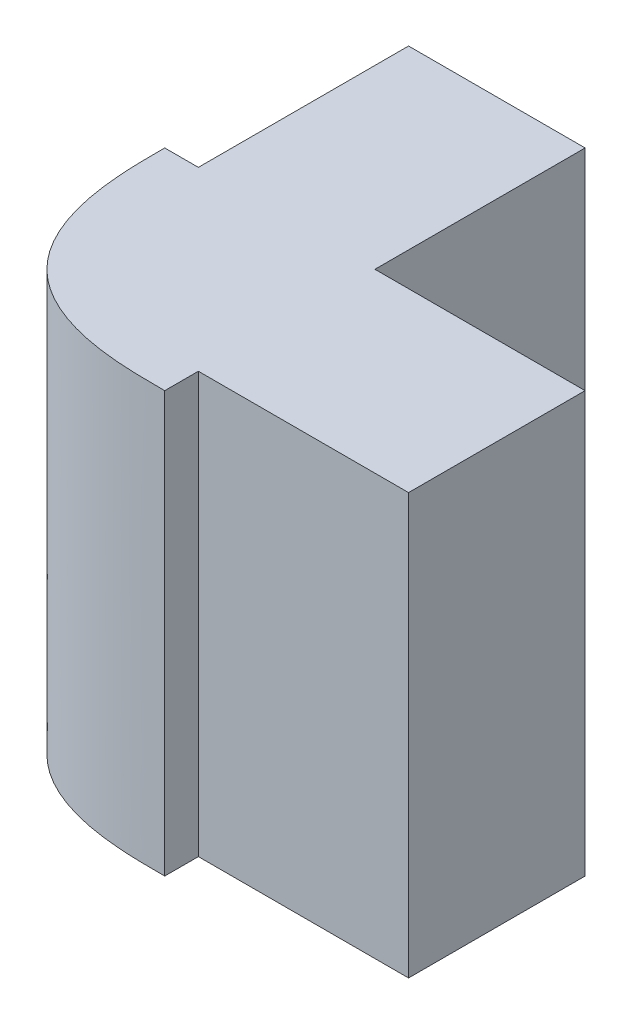
from build123d import *

# Parameters (mm, degrees)
BOSS_EXTRUDE1_DEPTH = 40
FILLET1_SIZE        = 20


with BuildPart() as part:
    # Sketch2 → Boss-Extrude1 (new body)
    with BuildSketch(Plane(origin=(0, 0, 0), x_dir=(1, 0, 0), z_dir=(0, 1, 0))):
        Polygon((-20, -40), (-20, -36.8), (0, -36.8), (0, -20), (-20, -20), (-20, 0), (-36.8, 0), (-36.8, -20), (-40, -20), (-40, -40), align=None)
    extrude(amount=BOSS_EXTRUDE1_DEPTH)

    # Fillet1
    # a fillet whose section is not a circle: 20 mm, written as the material it takes off along each edge
    with BuildSketch(Plane(origin=(-40, -50, 40), x_dir=(0, 0, -1), z_dir=(0, 1, 0))) as fillet1_piece_1:
        with BuildLine():
            add(Edge.make_bspline([(FILLET1_SIZE, 0), (FILLET1_SIZE * 0.831801948466, 0), (FILLET1_SIZE * 0.663603896932, 0), (FILLET1_SIZE * 0.292893218813, -FILLET1_SIZE * 0.0716919198361), (FILLET1_SIZE * 0.0716919198361, -FILLET1_SIZE * 0.292893218813), (0, -FILLET1_SIZE * 0.663603896932), (0, -FILLET1_SIZE * 0.831801948466), (0, -FILLET1_SIZE)], knots=[0, 0, 0, 0, 0, 0, 0.5, 0.5, 1, 1, 1, 1, 1, 1], degree=5))
            Line((0, -FILLET1_SIZE), (0, 0))
            Line((0, 0), (FILLET1_SIZE, 0))
        make_face()
    extrude(amount=140, mode=Mode.SUBTRACT)


solid = part.part
